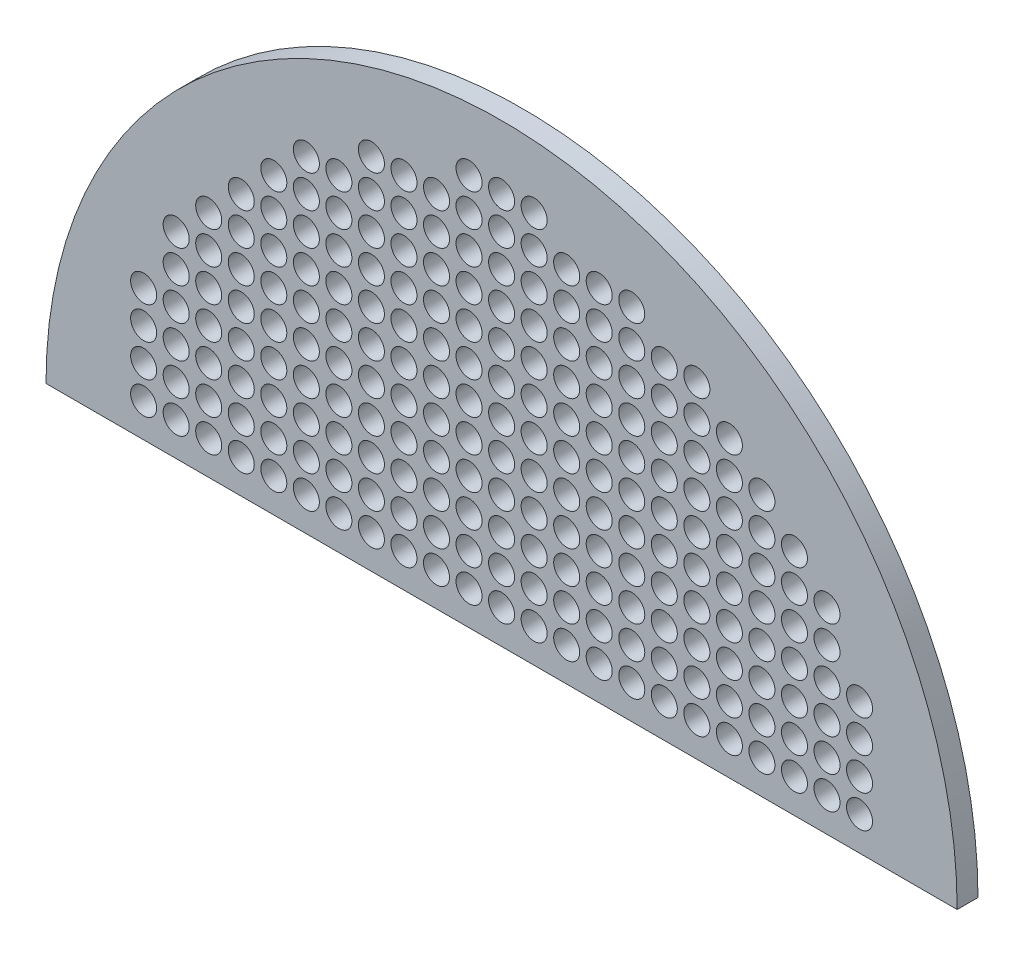
from build123d import *

# Parameters (mm, degrees)
SKETCH1_R           = 444.5
BOSS_EXTRUDE1_DEPTH = 20.32
SKETCH4_R           = 12.7
CUT_EXTRUDE1_DEPTH  = 76.2
SKETCH5_W           = 981.05796819
SKETCH5_H           = 168.376020334
CUT_EXTRUDE2_DEPTH  = 541.02


with BuildPart() as part:
    # Sketch1 → Boss-Extrude1 (new body)
    with BuildSketch(Plane.XY):
        Circle(SKETCH1_R)
    extrude(amount=-BOSS_EXTRUDE1_DEPTH)

    # Sketch4 → Cut-Extrude1 (cut)
    with BuildSketch(Plane.XY):
        with Locations((0, 33.02)):
            Circle(SKETCH4_R)
        with Locations((-31.75, 33.02)):
            Circle(SKETCH4_R)
        with Locations((-63.5, 33.02)):
            Circle(SKETCH4_R)
        with Locations((-95.25, 33.02)):
            Circle(SKETCH4_R)
        with Locations((-127, 33.02)):
            Circle(SKETCH4_R)
        with Locations((-158.75, 33.02)):
            Circle(SKETCH4_R)
        with Locations((-190.5, 33.02)):
            Circle(SKETCH4_R)
        with Locations((-222.25, 33.02)):
            Circle(SKETCH4_R)
        with Locations((-254, 33.02)):
            Circle(SKETCH4_R)
        with Locations((-285.75, 33.02)):
            Circle(SKETCH4_R)
        with Locations((-317.5, 33.02)):
            Circle(SKETCH4_R)
        with Locations((-349.25, 33.02)):
            Circle(SKETCH4_R)
        with Locations((-31.75, 64.77)):
            Circle(SKETCH4_R)
        with Locations((-63.5, 64.77)):
            Circle(SKETCH4_R)
        with Locations((-95.25, 64.77)):
            Circle(SKETCH4_R)
        with Locations((-127, 64.77)):
            Circle(SKETCH4_R)
        with Locations((-158.75, 64.77)):
            Circle(SKETCH4_R)
        with Locations((-190.5, 64.77)):
            Circle(SKETCH4_R)
        with Locations((-222.25, 64.77)):
            Circle(SKETCH4_R)
        with Locations((-254, 64.77)):
            Circle(SKETCH4_R)
        with Locations((-285.75, 64.77)):
            Circle(SKETCH4_R)
        with Locations((-317.5, 64.77)):
            Circle(SKETCH4_R)
        with Locations((-349.25, 64.77)):
            Circle(SKETCH4_R)
        with Locations((-31.75, 96.52)):
            Circle(SKETCH4_R)
        with Locations((-63.5, 96.52)):
            Circle(SKETCH4_R)
        with Locations((-95.25, 96.52)):
            Circle(SKETCH4_R)
        with Locations((-127, 96.52)):
            Circle(SKETCH4_R)
        with Locations((-158.75, 96.52)):
            Circle(SKETCH4_R)
        with Locations((-190.5, 96.52)):
            Circle(SKETCH4_R)
        with Locations((-222.25, 96.52)):
            Circle(SKETCH4_R)
        with Locations((-254, 96.52)):
            Circle(SKETCH4_R)
        with Locations((-285.75, 96.52)):
            Circle(SKETCH4_R)
        with Locations((-317.5, 96.52)):
            Circle(SKETCH4_R)
        with Locations((-349.25, 96.52)):
            Circle(SKETCH4_R)
        with Locations((-31.75, 128.27)):
            Circle(SKETCH4_R)
        with Locations((-63.5, 128.27)):
            Circle(SKETCH4_R)
        with Locations((-95.25, 128.27)):
            Circle(SKETCH4_R)
        with Locations((-127, 128.27)):
            Circle(SKETCH4_R)
        with Locations((-158.75, 128.27)):
            Circle(SKETCH4_R)
        with Locations((-190.5, 128.27)):
            Circle(SKETCH4_R)
        with Locations((-222.25, 128.27)):
            Circle(SKETCH4_R)
        with Locations((-254, 128.27)):
            Circle(SKETCH4_R)
        with Locations((-285.75, 128.27)):
            Circle(SKETCH4_R)
        with Locations((-317.5, 128.27)):
            Circle(SKETCH4_R)
        with Locations((-349.25, 128.27)):
            Circle(SKETCH4_R)
        with Locations((-31.75, 160.02)):
            Circle(SKETCH4_R)
        with Locations((-63.5, 160.02)):
            Circle(SKETCH4_R)
        with Locations((-95.25, 160.02)):
            Circle(SKETCH4_R)
        with Locations((-127, 160.02)):
            Circle(SKETCH4_R)
        with Locations((-158.75, 160.02)):
            Circle(SKETCH4_R)
        with Locations((-190.5, 160.02)):
            Circle(SKETCH4_R)
        with Locations((-222.25, 160.02)):
            Circle(SKETCH4_R)
        with Locations((-254, 160.02)):
            Circle(SKETCH4_R)
        with Locations((-285.75, 160.02)):
            Circle(SKETCH4_R)
        with Locations((-317.5, 160.02)):
            Circle(SKETCH4_R)
        with Locations((-31.75, 191.77)):
            Circle(SKETCH4_R)
        with Locations((-63.5, 191.77)):
            Circle(SKETCH4_R)
        with Locations((-95.25, 191.77)):
            Circle(SKETCH4_R)
        with Locations((-127, 191.77)):
            Circle(SKETCH4_R)
        with Locations((-158.75, 191.77)):
            Circle(SKETCH4_R)
        with Locations((-190.5, 191.77)):
            Circle(SKETCH4_R)
        with Locations((-222.25, 191.77)):
            Circle(SKETCH4_R)
        with Locations((-254, 191.77)):
            Circle(SKETCH4_R)
        with Locations((-285.75, 191.77)):
            Circle(SKETCH4_R)
        with Locations((-317.5, 191.77)):
            Circle(SKETCH4_R)
        with Locations((-31.75, 223.52)):
            Circle(SKETCH4_R)
        with Locations((-63.5, 223.52)):
            Circle(SKETCH4_R)
        with Locations((-95.25, 223.52)):
            Circle(SKETCH4_R)
        with Locations((-127, 223.52)):
            Circle(SKETCH4_R)
        with Locations((-158.75, 223.52)):
            Circle(SKETCH4_R)
        with Locations((-190.5, 223.52)):
            Circle(SKETCH4_R)
        with Locations((-222.25, 223.52)):
            Circle(SKETCH4_R)
        with Locations((-254, 223.52)):
            Circle(SKETCH4_R)
        with Locations((-285.75, 223.52)):
            Circle(SKETCH4_R)
        with Locations((-31.75, 255.27)):
            Circle(SKETCH4_R)
        with Locations((-63.5, 255.27)):
            Circle(SKETCH4_R)
        with Locations((-95.25, 255.27)):
            Circle(SKETCH4_R)
        with Locations((-127, 255.27)):
            Circle(SKETCH4_R)
        with Locations((-158.75, 255.27)):
            Circle(SKETCH4_R)
        with Locations((-190.5, 255.27)):
            Circle(SKETCH4_R)
        with Locations((-222.25, 255.27)):
            Circle(SKETCH4_R)
        with Locations((-254, 255.27)):
            Circle(SKETCH4_R)
        with Locations((-31.75, 287.02)):
            Circle(SKETCH4_R)
        with Locations((-63.5, 287.02)):
            Circle(SKETCH4_R)
        with Locations((-95.25, 287.02)):
            Circle(SKETCH4_R)
        with Locations((-127, 287.02)):
            Circle(SKETCH4_R)
        with Locations((-158.75, 287.02)):
            Circle(SKETCH4_R)
        with Locations((-190.5, 287.02)):
            Circle(SKETCH4_R)
        with Locations((-222.25, 287.02)):
            Circle(SKETCH4_R)
        with Locations((-31.75, 318.77)):
            Circle(SKETCH4_R)
        with Locations((-63.5, 318.77)):
            Circle(SKETCH4_R)
        with Locations((-95.25, 318.77)):
            Circle(SKETCH4_R)
        with Locations((-127, 318.77)):
            Circle(SKETCH4_R)
        with Locations((-158.75, 318.77)):
            Circle(SKETCH4_R)
        with Locations((-190.5, 318.77)):
            Circle(SKETCH4_R)
        with Locations((-31.75, 350.52)):
            Circle(SKETCH4_R)
        with Locations((-63.5, 350.52)):
            Circle(SKETCH4_R)
        with Locations((-95.25, 350.52)):
            Circle(SKETCH4_R)
        with Locations((-127, 350.52)):
            Circle(SKETCH4_R)
        with Locations((-31.75, 382.27)):
            Circle(SKETCH4_R)
        with Locations((0, 64.77)):
            Circle(SKETCH4_R)
        with Locations((0, 96.52)):
            Circle(SKETCH4_R)
        with Locations((0, 128.27)):
            Circle(SKETCH4_R)
        with Locations((0, 160.02)):
            Circle(SKETCH4_R)
        with Locations((0, 191.77)):
            Circle(SKETCH4_R)
        with Locations((0, 223.52)):
            Circle(SKETCH4_R)
        with Locations((0, 255.27)):
            Circle(SKETCH4_R)
        with Locations((0, 287.02)):
            Circle(SKETCH4_R)
        with Locations((0, 318.77)):
            Circle(SKETCH4_R)
        with Locations((0, 350.52)):
            Circle(SKETCH4_R)
        with Locations((0, 382.27)):
            Circle(SKETCH4_R)
        with Locations((63.5, 350.52)):
            Circle(SKETCH4_R)
        with Locations((31.75, 350.52)):
            Circle(SKETCH4_R)
        with Locations((63.5, 318.77)):
            Circle(SKETCH4_R)
        with Locations((31.75, 318.77)):
            Circle(SKETCH4_R)
        with Locations((31.75, 287.02)):
            Circle(SKETCH4_R)
        with Locations((63.5, 255.27)):
            Circle(SKETCH4_R)
        with Locations((31.75, 255.27)):
            Circle(SKETCH4_R)
        with Locations((63.5, 223.52)):
            Circle(SKETCH4_R)
        with Locations((31.75, 223.52)):
            Circle(SKETCH4_R)
        with Locations((31.75, 191.77)):
            Circle(SKETCH4_R)
        with Locations((63.5, 160.02)):
            Circle(SKETCH4_R)
        with Locations((31.75, 160.02)):
            Circle(SKETCH4_R)
        with Locations((63.5, 128.27)):
            Circle(SKETCH4_R)
        with Locations((31.75, 128.27)):
            Circle(SKETCH4_R)
        with Locations((349.25, 96.52)):
            Circle(SKETCH4_R)
        with Locations((317.5, 96.52)):
            Circle(SKETCH4_R)
        with Locations((285.75, 96.52)):
            Circle(SKETCH4_R)
        with Locations((254, 96.52)):
            Circle(SKETCH4_R)
        with Locations((222.25, 96.52)):
            Circle(SKETCH4_R)
        with Locations((190.5, 96.52)):
            Circle(SKETCH4_R)
        with Locations((158.75, 96.52)):
            Circle(SKETCH4_R)
        with Locations((127, 96.52)):
            Circle(SKETCH4_R)
        with Locations((95.25, 96.52)):
            Circle(SKETCH4_R)
        with Locations((63.5, 96.52)):
            Circle(SKETCH4_R)
        with Locations((31.75, 96.52)):
            Circle(SKETCH4_R)
        with Locations((349.25, 64.77)):
            Circle(SKETCH4_R)
        with Locations((317.5, 64.77)):
            Circle(SKETCH4_R)
        with Locations((285.75, 64.77)):
            Circle(SKETCH4_R)
        with Locations((254, 64.77)):
            Circle(SKETCH4_R)
        with Locations((222.25, 64.77)):
            Circle(SKETCH4_R)
        with Locations((190.5, 64.77)):
            Circle(SKETCH4_R)
        with Locations((158.75, 64.77)):
            Circle(SKETCH4_R)
        with Locations((127, 64.77)):
            Circle(SKETCH4_R)
        with Locations((95.25, 64.77)):
            Circle(SKETCH4_R)
        with Locations((63.5, 64.77)):
            Circle(SKETCH4_R)
        with Locations((31.75, 64.77)):
            Circle(SKETCH4_R)
        with Locations((349.25, 33.02)):
            Circle(SKETCH4_R)
        with Locations((317.5, 33.02)):
            Circle(SKETCH4_R)
        with Locations((285.75, 33.02)):
            Circle(SKETCH4_R)
        with Locations((254, 33.02)):
            Circle(SKETCH4_R)
        with Locations((222.25, 33.02)):
            Circle(SKETCH4_R)
        with Locations((190.5, 33.02)):
            Circle(SKETCH4_R)
        with Locations((158.75, 33.02)):
            Circle(SKETCH4_R)
        with Locations((127, 33.02)):
            Circle(SKETCH4_R)
        with Locations((95.25, 33.02)):
            Circle(SKETCH4_R)
        with Locations((63.5, 33.02)):
            Circle(SKETCH4_R)
        with Locations((31.75, 33.02)):
            Circle(SKETCH4_R)
        with Locations((127, 350.52)):
            Circle(SKETCH4_R)
        with Locations((95.25, 350.52)):
            Circle(SKETCH4_R)
        with Locations((190.5, 318.77)):
            Circle(SKETCH4_R)
        with Locations((127, 318.77)):
            Circle(SKETCH4_R)
        with Locations((95.25, 318.77)):
            Circle(SKETCH4_R)
        with Locations((222.25, 287.02)):
            Circle(SKETCH4_R)
        with Locations((190.5, 287.02)):
            Circle(SKETCH4_R)
        with Locations((158.75, 287.02)):
            Circle(SKETCH4_R)
        with Locations((95.25, 287.02)):
            Circle(SKETCH4_R)
        with Locations((254, 255.27)):
            Circle(SKETCH4_R)
        with Locations((222.25, 255.27)):
            Circle(SKETCH4_R)
        with Locations((190.5, 255.27)):
            Circle(SKETCH4_R)
        with Locations((158.75, 255.27)):
            Circle(SKETCH4_R)
        with Locations((127, 255.27)):
            Circle(SKETCH4_R)
        with Locations((95.25, 255.27)):
            Circle(SKETCH4_R)
        with Locations((285.75, 223.52)):
            Circle(SKETCH4_R)
        with Locations((254, 223.52)):
            Circle(SKETCH4_R)
        with Locations((222.25, 223.52)):
            Circle(SKETCH4_R)
        with Locations((158.75, 223.52)):
            Circle(SKETCH4_R)
        with Locations((127, 223.52)):
            Circle(SKETCH4_R)
        with Locations((95.25, 223.52)):
            Circle(SKETCH4_R)
        with Locations((317.5, 191.77)):
            Circle(SKETCH4_R)
        with Locations((285.75, 191.77)):
            Circle(SKETCH4_R)
        with Locations((254, 191.77)):
            Circle(SKETCH4_R)
        with Locations((222.25, 191.77)):
            Circle(SKETCH4_R)
        with Locations((190.5, 191.77)):
            Circle(SKETCH4_R)
        with Locations((158.75, 191.77)):
            Circle(SKETCH4_R)
        with Locations((127, 191.77)):
            Circle(SKETCH4_R)
        with Locations((95.25, 191.77)):
            Circle(SKETCH4_R)
        with Locations((317.5, 160.02)):
            Circle(SKETCH4_R)
        with Locations((285.75, 160.02)):
            Circle(SKETCH4_R)
        with Locations((254, 160.02)):
            Circle(SKETCH4_R)
        with Locations((222.25, 160.02)):
            Circle(SKETCH4_R)
        with Locations((190.5, 160.02)):
            Circle(SKETCH4_R)
        with Locations((158.75, 160.02)):
            Circle(SKETCH4_R)
        with Locations((127, 160.02)):
            Circle(SKETCH4_R)
        with Locations((95.25, 160.02)):
            Circle(SKETCH4_R)
        with Locations((349.25, 128.27)):
            Circle(SKETCH4_R)
        with Locations((317.5, 128.27)):
            Circle(SKETCH4_R)
        with Locations((285.75, 128.27)):
            Circle(SKETCH4_R)
        with Locations((254, 128.27)):
            Circle(SKETCH4_R)
        with Locations((222.25, 128.27)):
            Circle(SKETCH4_R)
        with Locations((190.5, 128.27)):
            Circle(SKETCH4_R)
        with Locations((158.75, 128.27)):
            Circle(SKETCH4_R)
        with Locations((127, 128.27)):
            Circle(SKETCH4_R)
        with Locations((95.25, 128.27)):
            Circle(SKETCH4_R)
        with Locations((127, 287.02)):
            Circle(SKETCH4_R)
        with Locations((63.5, 287.02)):
            Circle(SKETCH4_R)
        with Locations((63.5, 191.77)):
            Circle(SKETCH4_R)
        with Locations((190.5, 223.52)):
            Circle(SKETCH4_R)
        with Locations((158.75, 318.77)):
            Circle(SKETCH4_R)
        with Locations((31.75, 382.27)):
            Circle(SKETCH4_R)
        with Locations((31.75, -382.27)):
            Circle(SKETCH4_R)
        with Locations((158.75, -318.77)):
            Circle(SKETCH4_R)
        with Locations((190.5, -223.52)):
            Circle(SKETCH4_R)
        with Locations((63.5, -191.77)):
            Circle(SKETCH4_R)
        with Locations((63.5, -287.02)):
            Circle(SKETCH4_R)
        with Locations((127, -287.02)):
            Circle(SKETCH4_R)
        with Locations((95.25, -128.27)):
            Circle(SKETCH4_R)
        with Locations((127, -128.27)):
            Circle(SKETCH4_R)
        with Locations((158.75, -128.27)):
            Circle(SKETCH4_R)
        with Locations((190.5, -128.27)):
            Circle(SKETCH4_R)
        with Locations((222.25, -128.27)):
            Circle(SKETCH4_R)
        with Locations((254, -128.27)):
            Circle(SKETCH4_R)
        with Locations((285.75, -128.27)):
            Circle(SKETCH4_R)
        with Locations((317.5, -128.27)):
            Circle(SKETCH4_R)
        with Locations((349.25, -128.27)):
            Circle(SKETCH4_R)
        with Locations((95.25, -160.02)):
            Circle(SKETCH4_R)
        with Locations((127, -160.02)):
            Circle(SKETCH4_R)
        with Locations((158.75, -160.02)):
            Circle(SKETCH4_R)
        with Locations((190.5, -160.02)):
            Circle(SKETCH4_R)
        with Locations((222.25, -160.02)):
            Circle(SKETCH4_R)
        with Locations((254, -160.02)):
            Circle(SKETCH4_R)
        with Locations((285.75, -160.02)):
            Circle(SKETCH4_R)
        with Locations((317.5, -160.02)):
            Circle(SKETCH4_R)
        with Locations((95.25, -191.77)):
            Circle(SKETCH4_R)
        with Locations((127, -191.77)):
            Circle(SKETCH4_R)
        with Locations((158.75, -191.77)):
            Circle(SKETCH4_R)
        with Locations((190.5, -191.77)):
            Circle(SKETCH4_R)
        with Locations((222.25, -191.77)):
            Circle(SKETCH4_R)
        with Locations((254, -191.77)):
            Circle(SKETCH4_R)
        with Locations((285.75, -191.77)):
            Circle(SKETCH4_R)
        with Locations((317.5, -191.77)):
            Circle(SKETCH4_R)
        with Locations((95.25, -223.52)):
            Circle(SKETCH4_R)
        with Locations((127, -223.52)):
            Circle(SKETCH4_R)
        with Locations((158.75, -223.52)):
            Circle(SKETCH4_R)
        with Locations((222.25, -223.52)):
            Circle(SKETCH4_R)
        with Locations((254, -223.52)):
            Circle(SKETCH4_R)
        with Locations((285.75, -223.52)):
            Circle(SKETCH4_R)
        with Locations((95.25, -255.27)):
            Circle(SKETCH4_R)
        with Locations((127, -255.27)):
            Circle(SKETCH4_R)
        with Locations((158.75, -255.27)):
            Circle(SKETCH4_R)
        with Locations((190.5, -255.27)):
            Circle(SKETCH4_R)
        with Locations((222.25, -255.27)):
            Circle(SKETCH4_R)
        with Locations((254, -255.27)):
            Circle(SKETCH4_R)
        with Locations((95.25, -287.02)):
            Circle(SKETCH4_R)
        with Locations((158.75, -287.02)):
            Circle(SKETCH4_R)
        with Locations((190.5, -287.02)):
            Circle(SKETCH4_R)
        with Locations((222.25, -287.02)):
            Circle(SKETCH4_R)
        with Locations((95.25, -318.77)):
            Circle(SKETCH4_R)
        with Locations((127, -318.77)):
            Circle(SKETCH4_R)
        with Locations((190.5, -318.77)):
            Circle(SKETCH4_R)
        with Locations((95.25, -350.52)):
            Circle(SKETCH4_R)
        with Locations((127, -350.52)):
            Circle(SKETCH4_R)
        with Locations((31.75, -33.02)):
            Circle(SKETCH4_R)
        with Locations((63.5, -33.02)):
            Circle(SKETCH4_R)
        with Locations((95.25, -33.02)):
            Circle(SKETCH4_R)
        with Locations((127, -33.02)):
            Circle(SKETCH4_R)
        with Locations((158.75, -33.02)):
            Circle(SKETCH4_R)
        with Locations((190.5, -33.02)):
            Circle(SKETCH4_R)
        with Locations((222.25, -33.02)):
            Circle(SKETCH4_R)
        with Locations((254, -33.02)):
            Circle(SKETCH4_R)
        with Locations((285.75, -33.02)):
            Circle(SKETCH4_R)
        with Locations((317.5, -33.02)):
            Circle(SKETCH4_R)
        with Locations((349.25, -33.02)):
            Circle(SKETCH4_R)
        with Locations((31.75, -64.77)):
            Circle(SKETCH4_R)
        with Locations((63.5, -64.77)):
            Circle(SKETCH4_R)
        with Locations((95.25, -64.77)):
            Circle(SKETCH4_R)
        with Locations((127, -64.77)):
            Circle(SKETCH4_R)
        with Locations((158.75, -64.77)):
            Circle(SKETCH4_R)
        with Locations((190.5, -64.77)):
            Circle(SKETCH4_R)
        with Locations((222.25, -64.77)):
            Circle(SKETCH4_R)
        with Locations((254, -64.77)):
            Circle(SKETCH4_R)
        with Locations((285.75, -64.77)):
            Circle(SKETCH4_R)
        with Locations((317.5, -64.77)):
            Circle(SKETCH4_R)
        with Locations((349.25, -64.77)):
            Circle(SKETCH4_R)
        with Locations((31.75, -96.52)):
            Circle(SKETCH4_R)
        with Locations((63.5, -96.52)):
            Circle(SKETCH4_R)
        with Locations((95.25, -96.52)):
            Circle(SKETCH4_R)
        with Locations((127, -96.52)):
            Circle(SKETCH4_R)
        with Locations((158.75, -96.52)):
            Circle(SKETCH4_R)
        with Locations((190.5, -96.52)):
            Circle(SKETCH4_R)
        with Locations((222.25, -96.52)):
            Circle(SKETCH4_R)
        with Locations((254, -96.52)):
            Circle(SKETCH4_R)
        with Locations((285.75, -96.52)):
            Circle(SKETCH4_R)
        with Locations((317.5, -96.52)):
            Circle(SKETCH4_R)
        with Locations((349.25, -96.52)):
            Circle(SKETCH4_R)
        with Locations((31.75, -128.27)):
            Circle(SKETCH4_R)
        with Locations((63.5, -128.27)):
            Circle(SKETCH4_R)
        with Locations((31.75, -160.02)):
            Circle(SKETCH4_R)
        with Locations((63.5, -160.02)):
            Circle(SKETCH4_R)
        with Locations((31.75, -191.77)):
            Circle(SKETCH4_R)
        with Locations((31.75, -223.52)):
            Circle(SKETCH4_R)
        with Locations((63.5, -223.52)):
            Circle(SKETCH4_R)
        with Locations((31.75, -255.27)):
            Circle(SKETCH4_R)
        with Locations((63.5, -255.27)):
            Circle(SKETCH4_R)
        with Locations((31.75, -287.02)):
            Circle(SKETCH4_R)
        with Locations((31.75, -318.77)):
            Circle(SKETCH4_R)
        with Locations((63.5, -318.77)):
            Circle(SKETCH4_R)
        with Locations((31.75, -350.52)):
            Circle(SKETCH4_R)
        with Locations((63.5, -350.52)):
            Circle(SKETCH4_R)
        with Locations((0, -382.27)):
            Circle(SKETCH4_R)
        with Locations((0, -350.52)):
            Circle(SKETCH4_R)
        with Locations((0, -318.77)):
            Circle(SKETCH4_R)
        with Locations((0, -287.02)):
            Circle(SKETCH4_R)
        with Locations((0, -255.27)):
            Circle(SKETCH4_R)
        with Locations((0, -223.52)):
            Circle(SKETCH4_R)
        with Locations((0, -191.77)):
            Circle(SKETCH4_R)
        with Locations((0, -160.02)):
            Circle(SKETCH4_R)
        with Locations((0, -128.27)):
            Circle(SKETCH4_R)
        with Locations((0, -96.52)):
            Circle(SKETCH4_R)
        with Locations((0, -64.77)):
            Circle(SKETCH4_R)
        with Locations((-31.75, -382.27)):
            Circle(SKETCH4_R)
        with Locations((-127, -350.52)):
            Circle(SKETCH4_R)
        with Locations((-95.25, -350.52)):
            Circle(SKETCH4_R)
        with Locations((-63.5, -350.52)):
            Circle(SKETCH4_R)
        with Locations((-31.75, -350.52)):
            Circle(SKETCH4_R)
        with Locations((-190.5, -318.77)):
            Circle(SKETCH4_R)
        with Locations((-158.75, -318.77)):
            Circle(SKETCH4_R)
        with Locations((-127, -318.77)):
            Circle(SKETCH4_R)
        with Locations((-95.25, -318.77)):
            Circle(SKETCH4_R)
        with Locations((-63.5, -318.77)):
            Circle(SKETCH4_R)
        with Locations((-31.75, -318.77)):
            Circle(SKETCH4_R)
        with Locations((-222.25, -287.02)):
            Circle(SKETCH4_R)
        with Locations((-190.5, -287.02)):
            Circle(SKETCH4_R)
        with Locations((-158.75, -287.02)):
            Circle(SKETCH4_R)
        with Locations((-127, -287.02)):
            Circle(SKETCH4_R)
        with Locations((-95.25, -287.02)):
            Circle(SKETCH4_R)
        with Locations((-63.5, -287.02)):
            Circle(SKETCH4_R)
        with Locations((-31.75, -287.02)):
            Circle(SKETCH4_R)
        with Locations((-254, -255.27)):
            Circle(SKETCH4_R)
        with Locations((-222.25, -255.27)):
            Circle(SKETCH4_R)
        with Locations((-190.5, -255.27)):
            Circle(SKETCH4_R)
        with Locations((-158.75, -255.27)):
            Circle(SKETCH4_R)
        with Locations((-127, -255.27)):
            Circle(SKETCH4_R)
        with Locations((-95.25, -255.27)):
            Circle(SKETCH4_R)
        with Locations((-63.5, -255.27)):
            Circle(SKETCH4_R)
        with Locations((-31.75, -255.27)):
            Circle(SKETCH4_R)
        with Locations((-285.75, -223.52)):
            Circle(SKETCH4_R)
        with Locations((-254, -223.52)):
            Circle(SKETCH4_R)
        with Locations((-222.25, -223.52)):
            Circle(SKETCH4_R)
        with Locations((-190.5, -223.52)):
            Circle(SKETCH4_R)
        with Locations((-158.75, -223.52)):
            Circle(SKETCH4_R)
        with Locations((-127, -223.52)):
            Circle(SKETCH4_R)
        with Locations((-95.25, -223.52)):
            Circle(SKETCH4_R)
        with Locations((-63.5, -223.52)):
            Circle(SKETCH4_R)
        with Locations((-31.75, -223.52)):
            Circle(SKETCH4_R)
        with Locations((-317.5, -191.77)):
            Circle(SKETCH4_R)
        with Locations((-285.75, -191.77)):
            Circle(SKETCH4_R)
        with Locations((-254, -191.77)):
            Circle(SKETCH4_R)
        with Locations((-222.25, -191.77)):
            Circle(SKETCH4_R)
        with Locations((-190.5, -191.77)):
            Circle(SKETCH4_R)
        with Locations((-158.75, -191.77)):
            Circle(SKETCH4_R)
        with Locations((-127, -191.77)):
            Circle(SKETCH4_R)
        with Locations((-95.25, -191.77)):
            Circle(SKETCH4_R)
        with Locations((-63.5, -191.77)):
            Circle(SKETCH4_R)
        with Locations((-31.75, -191.77)):
            Circle(SKETCH4_R)
        with Locations((-317.5, -160.02)):
            Circle(SKETCH4_R)
        with Locations((-285.75, -160.02)):
            Circle(SKETCH4_R)
        with Locations((-254, -160.02)):
            Circle(SKETCH4_R)
        with Locations((-222.25, -160.02)):
            Circle(SKETCH4_R)
        with Locations((-190.5, -160.02)):
            Circle(SKETCH4_R)
        with Locations((-158.75, -160.02)):
            Circle(SKETCH4_R)
        with Locations((-127, -160.02)):
            Circle(SKETCH4_R)
        with Locations((-95.25, -160.02)):
            Circle(SKETCH4_R)
        with Locations((-63.5, -160.02)):
            Circle(SKETCH4_R)
        with Locations((-31.75, -160.02)):
            Circle(SKETCH4_R)
        with Locations((-349.25, -128.27)):
            Circle(SKETCH4_R)
        with Locations((-317.5, -128.27)):
            Circle(SKETCH4_R)
        with Locations((-285.75, -128.27)):
            Circle(SKETCH4_R)
        with Locations((-254, -128.27)):
            Circle(SKETCH4_R)
        with Locations((-222.25, -128.27)):
            Circle(SKETCH4_R)
        with Locations((-190.5, -128.27)):
            Circle(SKETCH4_R)
        with Locations((-158.75, -128.27)):
            Circle(SKETCH4_R)
        with Locations((-127, -128.27)):
            Circle(SKETCH4_R)
        with Locations((-95.25, -128.27)):
            Circle(SKETCH4_R)
        with Locations((-63.5, -128.27)):
            Circle(SKETCH4_R)
        with Locations((-31.75, -128.27)):
            Circle(SKETCH4_R)
        with Locations((-349.25, -96.52)):
            Circle(SKETCH4_R)
        with Locations((-317.5, -96.52)):
            Circle(SKETCH4_R)
        with Locations((-285.75, -96.52)):
            Circle(SKETCH4_R)
        with Locations((-254, -96.52)):
            Circle(SKETCH4_R)
        with Locations((-222.25, -96.52)):
            Circle(SKETCH4_R)
        with Locations((-190.5, -96.52)):
            Circle(SKETCH4_R)
        with Locations((-158.75, -96.52)):
            Circle(SKETCH4_R)
        with Locations((-127, -96.52)):
            Circle(SKETCH4_R)
        with Locations((-95.25, -96.52)):
            Circle(SKETCH4_R)
        with Locations((-63.5, -96.52)):
            Circle(SKETCH4_R)
        with Locations((-31.75, -96.52)):
            Circle(SKETCH4_R)
        with Locations((-349.25, -64.77)):
            Circle(SKETCH4_R)
        with Locations((-317.5, -64.77)):
            Circle(SKETCH4_R)
        with Locations((-285.75, -64.77)):
            Circle(SKETCH4_R)
        with Locations((-254, -64.77)):
            Circle(SKETCH4_R)
        with Locations((-222.25, -64.77)):
            Circle(SKETCH4_R)
        with Locations((-190.5, -64.77)):
            Circle(SKETCH4_R)
        with Locations((-158.75, -64.77)):
            Circle(SKETCH4_R)
        with Locations((-127, -64.77)):
            Circle(SKETCH4_R)
        with Locations((-95.25, -64.77)):
            Circle(SKETCH4_R)
        with Locations((-63.5, -64.77)):
            Circle(SKETCH4_R)
        with Locations((-31.75, -64.77)):
            Circle(SKETCH4_R)
        with Locations((-349.25, -33.02)):
            Circle(SKETCH4_R)
        with Locations((-317.5, -33.02)):
            Circle(SKETCH4_R)
        with Locations((-285.75, -33.02)):
            Circle(SKETCH4_R)
        with Locations((-254, -33.02)):
            Circle(SKETCH4_R)
        with Locations((-222.25, -33.02)):
            Circle(SKETCH4_R)
        with Locations((-190.5, -33.02)):
            Circle(SKETCH4_R)
        with Locations((-158.75, -33.02)):
            Circle(SKETCH4_R)
        with Locations((-127, -33.02)):
            Circle(SKETCH4_R)
        with Locations((-95.25, -33.02)):
            Circle(SKETCH4_R)
        with Locations((-63.5, -33.02)):
            Circle(SKETCH4_R)
        with Locations((-31.75, -33.02)):
            Circle(SKETCH4_R)
        with Locations((0, -33.02)):
            Circle(SKETCH4_R)
    extrude(amount=-CUT_EXTRUDE1_DEPTH, mode=Mode.SUBTRACT)

    # Sketch5 → Cut-Extrude2 (cut)
    with BuildSketch(Plane(origin=(0, 0, 0), x_dir=(1, 0, 0), z_dir=(0, 1, 0))):
        with Locations((0, 10.16)):
            Rectangle(SKETCH5_W, SKETCH5_H)
    extrude(amount=-CUT_EXTRUDE2_DEPTH, mode=Mode.SUBTRACT)


solid = part.part
